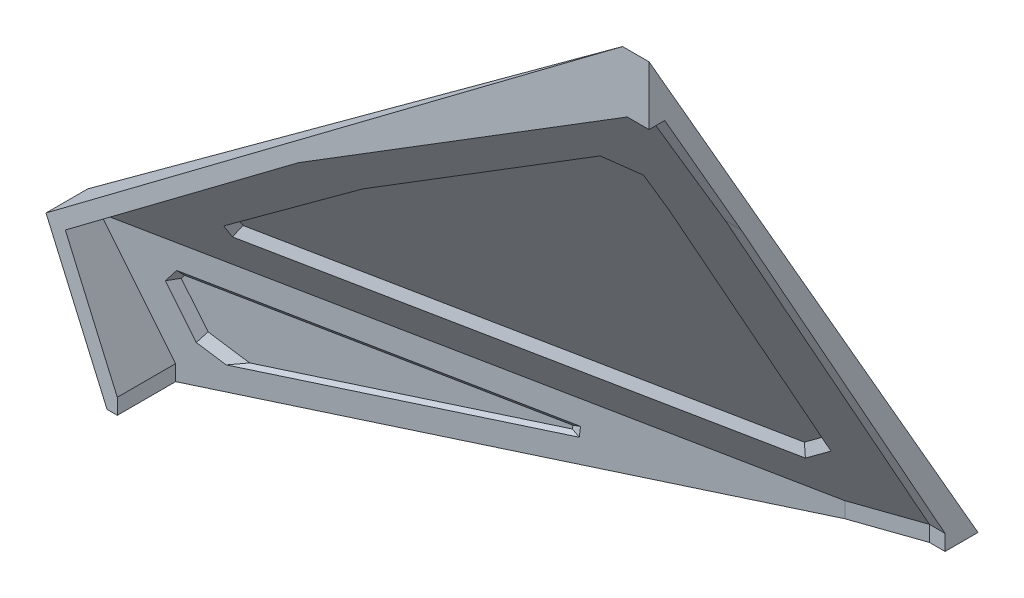
from build123d import *

# Parameters (mm, degrees)
BOSS_EXTRU_1_DEPTH       = 220
ENL_V_MAT_EXTRU_1_DEPTH  = 593.628391152
ENL_V_MAT_EXTRU_7_DEPTH  = 585.622735541
ENL_V_MAT_EXTRU_8_DEPTH  = 581.933509888
ENL_V_MAT_EXTRU_9_DEPTH  = 576.952076714
COQUE2_T                 = 10
ENL_V_MAT_EXTRU_10_DEPTH = 10
ENL_V_MAT_EXTRU_11_DEPTH = 10
ENL_V_MAT_EXTRU_12_DEPTH = 10
ENL_V_MAT_EXTRU_13_DEPTH = 5
ENL_V_MAT_EXTRU_14_DEPTH = 5
CHANFREIN1_SIZE          = 5


with BuildPart() as part:
    # Esquisse1 → Boss.-Extru.1 (new body)
    with BuildSketch(Plane.XY):
        Polygon((0, 0), (0, 300), (0, 377.9), (-400, 77.9), (-400, 0), align=None)
    extrude(amount=BOSS_EXTRU_1_DEPTH)

    # Esquisse2 → Enlèv. mat.-Extru.1 (cut, through all)
    with BuildSketch(Plane(origin=(0, 0, 0), x_dir=(0, 0, -1), z_dir=(1, 0, 0))):
        Polygon((-240, 400), (-10, 0), (0, 0), (0, 377.9), (0, 400), align=None)
    extrude(amount=-ENL_V_MAT_EXTRU_1_DEPTH, mode=Mode.SUBTRACT)

    # Esquisse9 → Enlèv. mat.-Extru.7 (cut, through all)
    with BuildSketch(Plane(origin=(0, 0, 0), x_dir=(-1, 0, 0), z_dir=(0, -1, 0))):
        Polygon((0, -10), (546, -270), (546, -10), align=None)
    extrude(amount=-ENL_V_MAT_EXTRU_7_DEPTH, mode=Mode.SUBTRACT)

    # Esquisse10 → Enlèv. mat.-Extru.8 (cut, through all)
    with BuildSketch(Plane.XY.offset(220)):
        Polygon((-400, 77.9), (-385, 89.15), (15, -825.85), (-400, -825.85), align=None)
    extrude(amount=-ENL_V_MAT_EXTRU_8_DEPTH, mode=Mode.SUBTRACT)

    # Esquisse11 → Enlèv. mat.-Extru.9 (cut, through all)
    with BuildSketch(Plane(origin=(2.420403375, -3.901436921, 6.980009459), x_dir=(-0.957115229324862, -0.14134879209424664, 0.25288526403868283), z_dir=(-0.2897075038628045, 0.46697817542256076, -0.8354645090514613))):
        Polygon((411.522876563, 185.157287383), (386.822778124, 107.338380422), (375.386020672, 85.272983458), (2.52885264, 4.879017292), (4.011720976, 426.13611676), (20.196678216, 426.13611676), align=None)
    extrude(amount=ENL_V_MAT_EXTRU_9_DEPTH, mode=Mode.SUBTRACT)

    # Coque2 (no face opened: a closed hollow body)
    add(offset(amount=-COQUE2_T, mode=Mode.PRIVATE), mode=Mode.SUBTRACT)

    # Esquisse12 → Enlèv. mat.-Extru.10 (cut)
    with BuildSketch(Plane(origin=(0, 0, 0), x_dir=(0, 0, -1), z_dir=(1, 0, 0))):
        Polygon((-220, 0), (-31.026454867, 0), (-31.026454867, 10), (-161.268107242, 243.013626517), (-210, 327.764744356), (-220, 327.764744356), align=None)
    extrude(amount=-ENL_V_MAT_EXTRU_10_DEPTH, mode=Mode.SUBTRACT)

    # Esquisse13 → Enlèv. mat.-Extru.11 (cut)
    with BuildSketch(Plane.XY.offset(220)):
        Polygon((-10, 327.764744356), (-13.924111282, 327.764744356), (-223.720300682, 197.609774488), (-372.665748674, 85.900688494), (-339.485119824, 10), (-339.485119824, 0), (0, 0), (0, 327.764744356), align=None)
    extrude(amount=-ENL_V_MAT_EXTRU_11_DEPTH, mode=Mode.SUBTRACT)

    # Esquisse14 → Enlèv. mat.-Extru.12 (cut)
    with BuildSketch(Plane(origin=(0, 10, 0), x_dir=(1, 0, 0), z_dir=(0, 1, 0))):
        Polygon((-10, -31.026454867), (-50.088935394, -44.927781949), (-339.485119824, -182.735488821), (-339.485119824, -210), (-10, -210), align=None)
    extrude(amount=-ENL_V_MAT_EXTRU_12_DEPTH, mode=Mode.SUBTRACT)

    # Esquisse15 → Enlèv. mat.-Extru.13 (cut)
    with BuildSketch(Plane(origin=(5.317478413, -8.571218675, 15.334654549), x_dir=(0.957115229324862, 0.14134879209424633, -0.25288526403868294), z_dir=(0.2897075038628044, -0.4669781754225606, 0.8354645090514614))):
        Polygon((-47.266156251, 320.279040761), (-65.860823636, 331.058022207), (-224.088873852, 249.046543535), (-324.264873355, 182.887396388), (-323.375809314, 173.536914552), (-64.470820642, 65.876603428), (-46.003797604, 78.19747196), (-46.003797604, 290.180399582), align=None)
    extrude(amount=-ENL_V_MAT_EXTRU_13_DEPTH, mode=Mode.SUBTRACT)

    # Esquisse16 → Enlèv. mat.-Extru.14 (cut)
    with BuildSketch(Plane(origin=(8.181036358, 0, 17.180176353), x_dir=(0.9028605188239304, 0, -0.4299335803923476), z_dir=(0.4299335803923476, 0, 0.9028605188239304))):
        Polygon((-191.754542227, 15), (-191.119657804, 21.139217145), (-384.586204292, 61.586295788), (-390.01662066, 54.63224463), (-375.184932722, 24.000456874), (-360.826977231, 15), align=None)
    extrude(amount=-ENL_V_MAT_EXTRU_14_DEPTH, mode=Mode.SUBTRACT)

    # Chanfrein1
    # the kernel refuses this chamfer: 5 mm, written as the material it adds along each edge
    with BuildSketch(Plane(origin=(-40.161994399, 44.295460011, 54.670053412), x_dir=(0.3159146926025526, -0.462915109925161, 0.8281953320327342), z_dir=(0, 0.8728985637819059, 0.48790172919091623))) as chanfrein1_piece_1_section:
        Polygon((CHANFREIN1_SIZE * 0.999621916911, -CHANFREIN1_SIZE * 0.0274958766106), (-CHANFREIN1_SIZE * 0.0274958766106, -CHANFREIN1_SIZE * 0.999621916911), (0, 0), align=None)
    chanfrein1_piece_1 = extrude(amount=237.699757502, mode=Mode.PRIVATE)
    chanfrein1_piece_1 = split(chanfrein1_piece_1, bisect_by=Plane(origin=(-40.208550671, 46.8969516, 62.124981095), z_dir=(-0.2897075038628046, 0.46697817542256076, -0.8354645090514613)), keep=Keep.TOP, mode=Mode.PRIVATE)
    add(chanfrein1_piece_1)
    with BuildSketch(Plane(origin=(-68.07465725, 34.413144895, 58.825445246), x_dir=(0.30420367327836906, -0.4846099980151233, 0.8201300354137321), z_dir=(0.7961785265635489, 0.602037439248781, 0.060420820764590655))) as chanfrein1_piece_2_section:
        Polygon((CHANFREIN1_SIZE * 0.999621916911, -CHANFREIN1_SIZE * 0.0274958766106), (-CHANFREIN1_SIZE * 0.0274958766106, -CHANFREIN1_SIZE * 0.999621916911), (0, 0), align=None)
    chanfrein1_piece_2 = extrude(amount=47.916711439, mode=Mode.PRIVATE)
    chanfrein1_piece_2 = split(chanfrein1_piece_2, bisect_by=Plane(origin=(-62.751981741, 36.64687929, 64.212970543), z_dir=(-0.2897075038628046, 0.46697817542256076, -0.8354645090514613)), keep=Keep.TOP, mode=Mode.PRIVATE)
    add(chanfrein1_piece_2)
    with BuildSketch(Plane(origin=(-317.002639554, 102.166369021, 183.014540357), x_dir=(0.27949349185715106, -0.4904553232059303, 0.8254313805207935), z_dir=(0.8837534495057562, -0.20464057148945075, -0.42083497595512176))) as chanfrein1_piece_3_section:
        Polygon((CHANFREIN1_SIZE * 0.999621916911, -CHANFREIN1_SIZE * 0.0274958766106), (-CHANFREIN1_SIZE * 0.0274958766106, -CHANFREIN1_SIZE * 0.999621916911), (0, 0), align=None)
    chanfrein1_piece_3 = extrude(amount=306.113933558, mode=Mode.PRIVATE)
    chanfrein1_piece_3 = split(chanfrein1_piece_3, bisect_by=Plane(origin=(-309.662798292, 99.962525559, 185.222229721), z_dir=(-0.2897075038628046, 0.46697817542256076, -0.8354645090514613)), keep=Keep.TOP, mode=Mode.PRIVATE)
    add(chanfrein1_piece_3)
    with BuildSketch(Plane(origin=(-307.65482851, 118.573028738, 188.943482833), x_dir=(0.2633994072478335, -0.4729425091279115, 0.8408008892248422), z_dir=(0.09059598606414514, -0.8555999408705789, -0.5096480241218712))) as chanfrein1_piece_4_section:
        Polygon((CHANFREIN1_SIZE * 0.999621916911, -CHANFREIN1_SIZE * 0.0274958766106), (-CHANFREIN1_SIZE * 0.0274958766106, -CHANFREIN1_SIZE * 0.999621916911), (0, 0), align=None)
    chanfrein1_piece_4 = extrude(amount=35.10948368, mode=Mode.PRIVATE)
    chanfrein1_piece_4 = split(chanfrein1_piece_4, bisect_by=Plane(origin=(-304.154916551, 111.450481176, 189.733432581), z_dir=(-0.2897075038628046, 0.46697817542256076, -0.8354645090514613)), keep=Keep.TOP, mode=Mode.PRIVATE)
    add(chanfrein1_piece_4)
    with BuildSketch(Plane(origin=(-200.340434194, 187.183474827, 190.080330196), x_dir=(0.27509504551843234, -0.44891584015791836, 0.8501748551836392), z_dir=(-0.7986597762217562, -0.5989948321663171, -0.05785976912726176))) as chanfrein1_piece_5_section:
        Polygon((CHANFREIN1_SIZE * 0.999621916911, -CHANFREIN1_SIZE * 0.0274958766106), (-CHANFREIN1_SIZE * 0.0274958766106, -CHANFREIN1_SIZE * 0.999621916911), (0, 0), align=None)
    chanfrein1_piece_5 = extrude(amount=145.767917453, mode=Mode.PRIVATE)
    chanfrein1_piece_5 = split(chanfrein1_piece_5, bisect_by=Plane(origin=(-202.533814806, 181.753905632, 193.790779261), z_dir=(-0.2897075038628046, 0.46697817542256076, -0.8354645090514613)), keep=Keep.TOP, mode=Mode.PRIVATE)
    add(chanfrein1_piece_5)
    with BuildSketch(Plane(origin=(-48.240952428, 280.213064842, 189.336345276), x_dir=(0.2774877365282881, -0.4472811894008833, 0.8502588392275253), z_dir=(-0.8497551250873772, -0.5271776051652194, 0))) as chanfrein1_piece_6_section:
        Polygon((CHANFREIN1_SIZE * 0.999621916911, -CHANFREIN1_SIZE * 0.0274958766106), (-CHANFREIN1_SIZE * 0.0274958766106, -CHANFREIN1_SIZE * 0.999621916911), (0, 0), align=None)
    chanfrein1_piece_6 = extrude(amount=203.93579214, mode=Mode.PRIVATE)
    chanfrein1_piece_6 = split(chanfrein1_piece_6, bisect_by=Plane(origin=(-51.141678834, 273.639790239, 192.652807431), z_dir=(-0.2897075038628046, 0.46697817542256076, -0.8354645090514613)), keep=Keep.TOP, mode=Mode.PRIVATE)
    add(chanfrein1_piece_6)
    with BuildSketch(Plane(origin=(-30.722819132, 262.597188686, 173.415424362), x_dir=(0.30279611641961773, -0.4440879078496585, 0.8432677166730093), z_dir=(-0.8280490249451176, 0.31548088408434294, 0.46347235523254393))) as chanfrein1_piece_7_section:
        Polygon((CHANFREIN1_SIZE * 0.999621916911, -CHANFREIN1_SIZE * 0.0274958766106), (-CHANFREIN1_SIZE * 0.0274958766106, -CHANFREIN1_SIZE * 0.999621916911), (0, 0), align=None)
    chanfrein1_piece_7 = extrude(amount=47.209807713, mode=Mode.PRIVATE)
    chanfrein1_piece_7 = split(chanfrein1_piece_7, bisect_by=Plane(origin=(-34.936696237, 260.839111264, 179.878664837), z_dir=(-0.2897075038628046, 0.46697817542256076, -0.8354645090514613)), keep=Keep.TOP, mode=Mode.PRIVATE)
    add(chanfrein1_piece_7)
    with BuildSketch(Plane(origin=(-39.646283985, 229.421072997, 157.966141832), x_dir=(0.31589157722178685, -0.46191278396742486, 0.8287635920139076), z_dir=(-0.04010684179965448, 0.8662087875824183, 0.498070052859891))) as chanfrein1_piece_8_section:
        Polygon((CHANFREIN1_SIZE * 0.999621916911, -CHANFREIN1_SIZE * 0.0274958766106), (-CHANFREIN1_SIZE * 0.0274958766106, -CHANFREIN1_SIZE * 0.999621916911), (0, 0), align=None)
    chanfrein1_piece_8 = extrude(amount=55.841931543, mode=Mode.PRIVATE)
    chanfrein1_piece_8 = split(chanfrein1_piece_8, bisect_by=Plane(origin=(-38.499704125, 231.686313872, 164.819389576), z_dir=(-0.2897075038628046, 0.46697817542256076, -0.8354645090514613)), keep=Keep.TOP, mode=Mode.PRIVATE)
    add(chanfrein1_piece_8)
    with BuildSketch(Plane(origin=(-342.544767506, 30.829984913, 178.654509931), x_dir=(0.41658568505778765, -0.023296939600526662, 0.9087978981105664), z_dir=(0.7649833199588183, -0.5311329639949918, -0.36427777140896095))) as chanfrein1_piece_9_section:
        Polygon((CHANFREIN1_SIZE * 0.999621916911, -CHANFREIN1_SIZE * 0.0274958766106), (-CHANFREIN1_SIZE * 0.0274958766106, -CHANFREIN1_SIZE * 0.999621916911), (0, 0), align=None)
    chanfrein1_piece_9 = extrude(amount=42.662599553, mode=Mode.PRIVATE)
    chanfrein1_piece_9 = split(chanfrein1_piece_9, bisect_by=Plane(origin=(-335.660362509, 29.200535476, 180.914175814), z_dir=(-0.42993358039234775, 0, -0.9028605188239304)), keep=Keep.TOP, mode=Mode.PRIVATE)
    add(chanfrein1_piece_9)
    with BuildSketch(Plane(origin=(-351.15854534, 66.205405543, 182.7563089), x_dir=(0.40742744830986827, -0.011982580645932633, 0.9131589632286229), z_dir=(0.3934625955758405, -0.9000456873797399, -0.18736314075040017))) as chanfrein1_piece_10_section:
        Polygon((CHANFREIN1_SIZE * 0.999621916911, -CHANFREIN1_SIZE * 0.0274958766106), (-CHANFREIN1_SIZE * 0.0274958766106, -CHANFREIN1_SIZE * 0.999621916911), (0, 0), align=None)
    chanfrein1_piece_10 = extrude(amount=59.750421935, mode=Mode.PRIVATE)
    chanfrein1_piece_10 = split(chanfrein1_piece_10, bisect_by=Plane(origin=(-345.34283002, 61.461742689, 185.524874628), z_dir=(-0.42993358039234775, 0, -0.9028605188239304)), keep=Keep.TOP, mode=Mode.PRIVATE)
    add(chanfrein1_piece_10)
    with BuildSketch(Plane(origin=(-334.051091784, 71.720762303, 174.609902444), x_dir=(0.41020504604213787, 0.01692295790963476, 0.911836297641828), z_dir=(-0.5556858860955991, -0.7881583042423078, 0.2646123267121899))) as chanfrein1_piece_11_section:
        Polygon((CHANFREIN1_SIZE * 0.999621916911, -CHANFREIN1_SIZE * 0.0274958766106), (-CHANFREIN1_SIZE * 0.0274958766106, -CHANFREIN1_SIZE * 0.999621916911), (0, 0), align=None)
    chanfrein1_piece_11 = extrude(amount=34.53999538, mode=Mode.PRIVATE)
    chanfrein1_piece_11 = split(chanfrein1_piece_11, bisect_by=Plane(origin=(-334.127686144, 65.984062058, 180.184329926), z_dir=(-0.42993358039234775, 0, -0.9028605188239304)), keep=Keep.TOP, mode=Mode.PRIVATE)
    add(chanfrein1_piece_11)
    with BuildSketch(Plane(origin=(-155.159356387, 18.507863763, 89.423361779), x_dir=(0.43485121997615706, 0.02691398648535738, 0.900100024339914), z_dir=(-0.8837534495057563, 0.20464057148945047, 0.42083497595512187))) as chanfrein1_piece_12_section:
        Polygon((CHANFREIN1_SIZE * 0.999621916911, -CHANFREIN1_SIZE * 0.0274958766106), (-CHANFREIN1_SIZE * 0.0274958766106, -CHANFREIN1_SIZE * 0.999621916911), (0, 0), align=None)
    chanfrein1_piece_12 = extrude(amount=223.366193099, mode=Mode.PRIVATE)
    chanfrein1_piece_12 = split(chanfrein1_piece_12, bisect_by=Plane(origin=(-158.919465377, 18.201780851, 96.751843846), z_dir=(-0.42993358039234775, 0, -0.9028605188239304)), keep=Keep.TOP, mode=Mode.PRIVATE)
    add(chanfrein1_piece_12)
    with BuildSketch(Plane(origin=(-168.290444566, 2.209796043, 95.676260912), x_dir=(0.45446428049870663, -0.002828389920449722, 0.8907604717101286), z_dir=(0.09287361982234821, 0.9946952261622446, -0.04422553324873722))) as chanfrein1_piece_13_section:
        Polygon((CHANFREIN1_SIZE * 0.999621916911, -CHANFREIN1_SIZE * 0.0274958766106), (-CHANFREIN1_SIZE * 0.0274958766106, -CHANFREIN1_SIZE * 0.999621916911), (0, 0), align=None)
    chanfrein1_piece_13 = extrude(amount=31.888787866, mode=Mode.PRIVATE)
    chanfrein1_piece_13 = split(chanfrein1_piece_13, bisect_by=Plane(origin=(-167.023575776, 8.689202011, 100.610944036), z_dir=(-0.42993358039234775, 0, -0.9028605188239304)), keep=Keep.TOP, mode=Mode.PRIVATE)
    add(chanfrein1_piece_13)


solid = part.part
